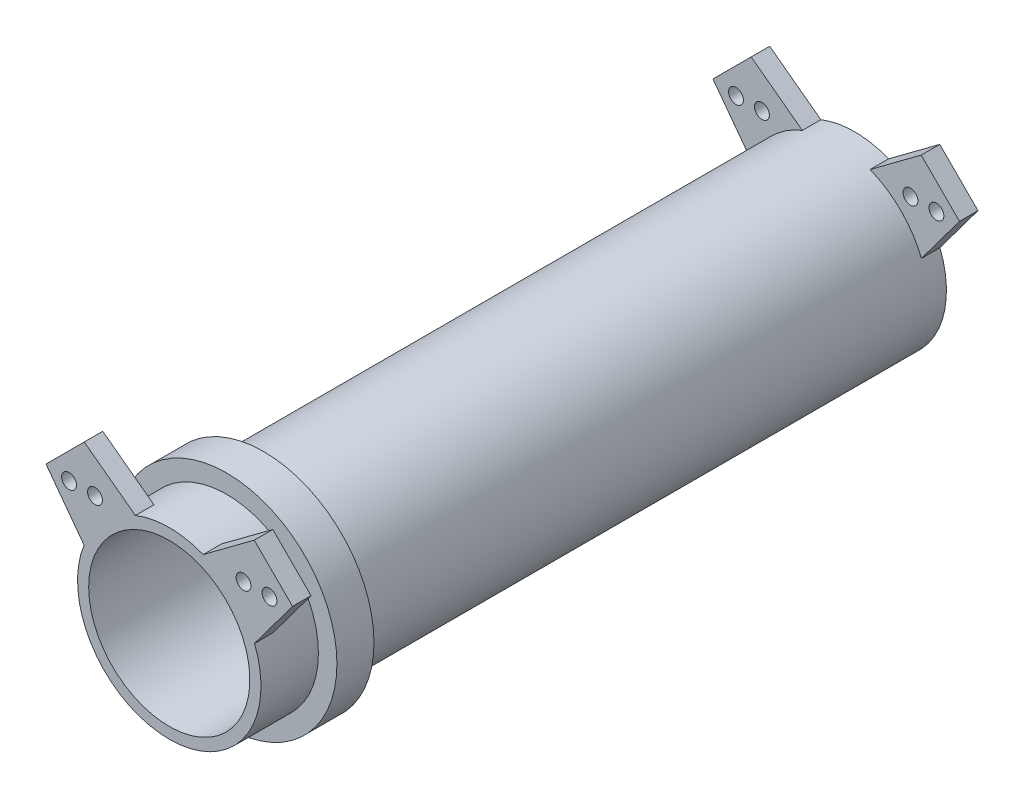
from build123d import *

# Parameters (mm, degrees)
SKETCH1_R             = 24.75
SKETCH1_R_2           = 21.75
BOSS_EXTRUDE1_DEPTH   = 90
BOSS_EXTRUDE3_START   = 72
SKETCH5_R             = 29.75
SKETCH5_R_2           = 21.75
BOSS_EXTRUDE3_DEPTH   = 5
SKETCH7_R             = 24.75
SKETCH7_R_2           = 21.75
BOSS_EXTRUDE4_DEPTH   = 2.5
BOSS_EXTRUDE5_START   = -5
SKETCH6_R             = 2
BOSS_EXTRUDE5_DEPTH   = 5
MIRROR2_START         = -92.5
MIRROR2_OUTLINE_R     = 24.75
MIRROR2_OUTLINE_R_2   = 21.75
MIRROR2_DEPTH         = 92.5
MIRROR2_START_2       = 67
MIRROR2_2_OUTLINE_R   = 29.75
MIRROR2_2_OUTLINE_R_2 = 24.75
MIRROR2_2_DEPTH       = 5
MIRROR2_3_OUTLINE_R   = 2
MIRROR2_3_DEPTH       = 5


# Read off the part's stored shape, not the designer's step: Mirror2
with BuildPart() as part:
    # Sketch1 → Boss-Extrude1 (new body)
    with BuildSketch(Plane.XY):
        with Locations(Location((0, 0, 0), (0, 0, 180))):
            Circle(SKETCH1_R)
        with Locations(Location((0, 0, 0), (0, 0, 180))):
            Circle(SKETCH1_R_2, mode=Mode.SUBTRACT)
    extrude(amount=BOSS_EXTRUDE1_DEPTH)

    # Sketch5 → Boss-Extrude3 (add)
    with BuildSketch(Plane.XY.offset(BOSS_EXTRUDE3_START)):
        Circle(SKETCH5_R)
        with Locations(Location((0, 0, 0), (0, 0, 180))):
            Circle(SKETCH5_R_2, mode=Mode.SUBTRACT)
    extrude(amount=BOSS_EXTRUDE3_DEPTH)

    # Sketch7 → Boss-Extrude4 (add, symmetric)
    with BuildSketch(Plane.XY.offset(90)):
        with Locations(Location((0, 0, 0), (0, 0, 180))):
            Circle(SKETCH7_R)
        with Locations(Location((0, 0, 0), (0, 0, 180))):
            Circle(SKETCH7_R_2, mode=Mode.SUBTRACT)
    extrude(amount=BOSS_EXTRUDE4_DEPTH, both=True)

    # Sketch6 → Boss-Extrude5 (add)
    with BuildSketch(Plane.XY.offset(92.5).offset(BOSS_EXTRUDE5_START)):
        with BuildLine():
            Line((-22.997666259, 9.147122314), (-33.267406372, 22.947582732))
            Line((-33.267406372, 22.947582732), (-22.947582732, 33.267406372))
            Line((-22.947582732, 33.267406372), (-9.147122314, 22.997666259))
            ThreePointArc((-9.147122314, 22.997666259), (-17.500892834, 17.500892834), (-22.997666259, 9.147122314))
        make_face()
        with Locations((-20.04683438, 22.097086912)):
            Circle(SKETCH6_R, mode=Mode.SUBTRACT)
        with Locations((-27.04683438, 22.097086912)):
            Circle(SKETCH6_R, mode=Mode.SUBTRACT)
    boss_extrude5 = extrude(amount=BOSS_EXTRUDE5_DEPTH)

    # Mirror1: Boss-Extrude5 across plane
    add(boss_extrude5.mirror(Plane(origin=(0, 0, 0), x_dir=(0, 0, 1), z_dir=(1, 0, 0))))

    # Mirror2 outline → Mirror2 (add)
    with BuildSketch(Plane.XY.offset(MIRROR2_START)):
        Circle(MIRROR2_OUTLINE_R)
        Circle(MIRROR2_OUTLINE_R_2, mode=Mode.SUBTRACT)
    extrude(amount=MIRROR2_DEPTH)

    # Mirror2 2 outline → Mirror2 2 (add)
    with BuildSketch(Plane.XY.offset(MIRROR2_START_2)):
        Circle(MIRROR2_2_OUTLINE_R)
        Circle(MIRROR2_2_OUTLINE_R_2, mode=Mode.SUBTRACT)
    extrude(amount=MIRROR2_2_DEPTH)

    # Mirror2 3 outline → Mirror2 3 (add)
    # profile 1 of 2: a face of its own
    with BuildSketch(Plane.XY.offset(MIRROR2_START)):
        with BuildLine():
            ThreePointArc((9.147122314, 22.997666259), (17.500892834, 17.500892834), (22.997666259, 9.147122314))
            Line((22.997666259, 9.147122314), (33.267406372, 22.947582732))
            Line((33.267406372, 22.947582732), (22.947582732, 33.267406372))
            Line((22.947582732, 33.267406372), (9.147122314, 22.997666259))
        make_face()
        with Locations((20.04683438, 22.097086912)):
            Circle(MIRROR2_3_OUTLINE_R, mode=Mode.SUBTRACT)
        with Locations((27.04683438, 22.097086912)):
            Circle(MIRROR2_3_OUTLINE_R, mode=Mode.SUBTRACT)
    # profile 2 of 2: a face of its own
    with BuildSketch(Plane.XY.offset(MIRROR2_START)):
        with BuildLine():
            ThreePointArc((-22.997666259, 9.147122314), (-17.500892834, 17.500892834), (-9.147122314, 22.997666259))
            Line((-9.147122314, 22.997666259), (-22.947582732, 33.267406372))
            Line((-22.947582732, 33.267406372), (-33.267406372, 22.947582732))
            Line((-33.267406372, 22.947582732), (-22.997666259, 9.147122314))
        make_face()
        with Locations((-20.04683438, 22.097086912)):
            Circle(MIRROR2_3_OUTLINE_R, mode=Mode.SUBTRACT)
        with Locations((-27.04683438, 22.097086912)):
            Circle(MIRROR2_3_OUTLINE_R, mode=Mode.SUBTRACT)
    extrude(amount=MIRROR2_3_DEPTH)


solid = part.part
